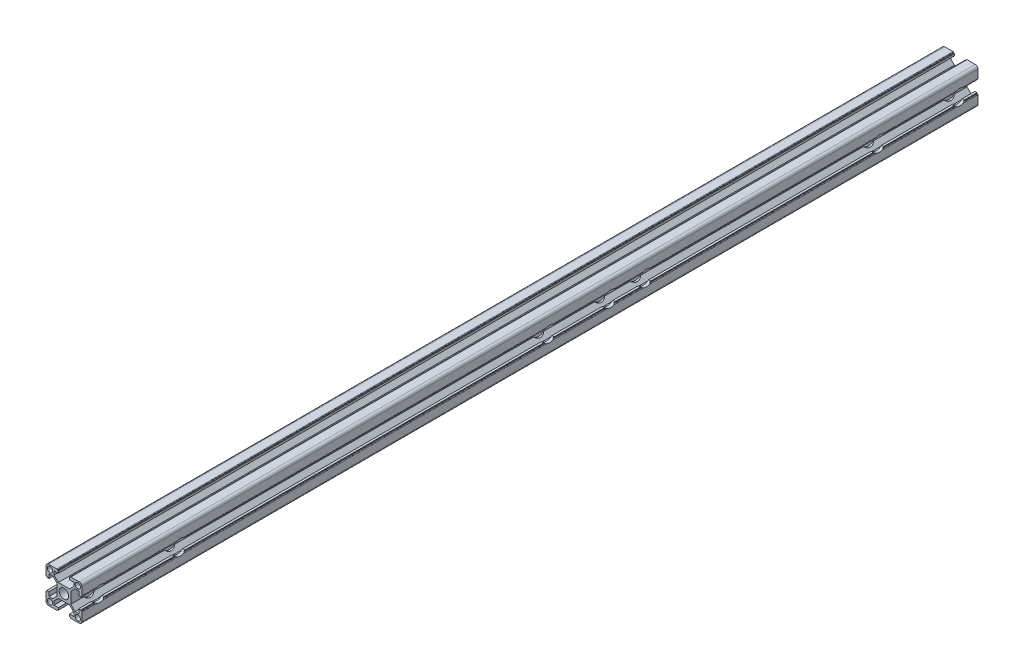
from build123d import *

# Parameters (mm, degrees)
SKETCH_1_R          = 2.65
SKETCH_1_R_2        = 1.5
EXTRUDE_1_DEPTH     = 250
SKETCH_4_R          = 2
CUT_EXTRUDE_3_DEPTH = 251.582965303
SKETCH_5_R          = 4.25
CUT_EXTRUDE_4_DEPTH = 251.582965403
SKETCH_6_R          = 2
CUT_EXTRUDE_5_DEPTH = 251.582965403
SKETCH_7_R          = 4.25
CUT_EXTRUDE_6_DEPTH = 251.582965403
SKETCH_8_R          = 2.1
CUT_EXTRUDE_7_DEPTH = 251.582965403
SKETCH_9_R          = 4.25
CUT_EXTRUDE_8_DEPTH = 251.582965408


with BuildPart() as part:
    # 草图1 → 凸台-拉伸1 (new, symmetric)
    with BuildSketch(Plane.XY):
        with BuildLine():
            Line((3.142893219, 3.85), (-3.142893219, 3.85))
            Line((-3.142893219, 3.85), (-5.5, 6.207106781))
            Line((-5.5, 6.207106781), (-5.5, 8.3))
            Line((-5.5, 8.3), (-3.1, 8.3))
            Line((-3.1, 8.3), (-3.1, 9.5))
            Line((-3.1, 9.5), (-3.6, 9.5))
            Line((-3.6, 9.5), (-3.6, 9.7))
            ThreePointArc((-3.6, 9.7), (-3.687867966, 9.912132034), (-3.9, 10))
            Line((-3.9, 10), (-8.5, 10))
            ThreePointArc((-8.5, 10), (-9.560660172, 9.560660172), (-10, 8.5))
            Line((-10, 8.5), (-10, 3.9))
            ThreePointArc((-10, 3.9), (-9.912132034, 3.687867966), (-9.7, 3.6))
            Line((-9.7, 3.6), (-9.5, 3.6))
            Line((-9.5, 3.6), (-9.5, 3.1))
            Line((-9.5, 3.1), (-8.3, 3.1))
            Line((-8.3, 3.1), (-8.3, 5.5))
            Line((-8.3, 5.5), (-6.207106781, 5.5))
            Line((-6.207106781, 5.5), (-3.85, 3.142893219))
            Line((-3.85, 3.142893219), (-3.85, -3.142893219))
            Line((-3.85, -3.142893219), (-6.207106781, -5.5))
            Line((-6.207106781, -5.5), (-8.3, -5.5))
            Line((-8.3, -5.5), (-8.3, -3.1))
            Line((-8.3, -3.1), (-9.5, -3.1))
            Line((-9.5, -3.1), (-9.5, -3.6))
            Line((-9.5, -3.6), (-9.7, -3.6))
            ThreePointArc((-9.7, -3.6), (-9.912132034, -3.687867966), (-10, -3.9))
            Line((-10, -3.9), (-10, -8.5))
            ThreePointArc((-10, -8.5), (-9.560660172, -9.560660172), (-8.5, -10))
            Line((-8.5, -10), (-3.9, -10))
            ThreePointArc((-3.9, -10), (-3.687867966, -9.912132034), (-3.6, -9.7))
            Line((-3.6, -9.7), (-3.6, -9.5))
            Line((-3.6, -9.5), (-3.1, -9.5))
            Line((-3.1, -9.5), (-3.1, -8.3))
            Line((-3.1, -8.3), (-5.5, -8.3))
            Line((-5.5, -8.3), (-5.5, -6.207106781))
            Line((-5.5, -6.207106781), (-3.142893219, -3.85))
            Line((-3.142893219, -3.85), (3.142893219, -3.85))
            Line((3.142893219, -3.85), (5.5, -6.207106781))
            Line((5.5, -6.207106781), (5.5, -8.3))
            Line((5.5, -8.3), (3.1, -8.3))
            Line((3.1, -8.3), (3.1, -9.5))
            Line((3.1, -9.5), (3.6, -9.5))
            Line((3.6, -9.5), (3.6, -9.7))
            ThreePointArc((3.6, -9.7), (3.687867966, -9.912132034), (3.9, -10))
            Line((3.9, -10), (8.5, -10))
            ThreePointArc((8.5, -10), (9.560660172, -9.560660172), (10, -8.5))
            Line((10, -8.5), (10, -3.9))
            ThreePointArc((10, -3.9), (9.912132034, -3.687867966), (9.7, -3.6))
            Line((9.7, -3.6), (9.5, -3.6))
            Line((9.5, -3.6), (9.5, -3.1))
            Line((9.5, -3.1), (8.3, -3.1))
            Line((8.3, -3.1), (8.3, -5.5))
            Line((8.3, -5.5), (6.207106781, -5.5))
            Line((6.207106781, -5.5), (3.85, -3.142893219))
            Line((3.85, -3.142893219), (3.85, 3.142893219))
            Line((3.85, 3.142893219), (6.207106781, 5.5))
            Line((6.207106781, 5.5), (8.3, 5.5))
            Line((8.3, 5.5), (8.3, 3.1))
            Line((8.3, 3.1), (9.5, 3.1))
            Line((9.5, 3.1), (9.5, 3.6))
            Line((9.5, 3.6), (9.7, 3.6))
            ThreePointArc((9.7, 3.6), (9.912132034, 3.687867966), (10, 3.9))
            Line((10, 3.9), (10, 8.5))
            ThreePointArc((10, 8.5), (9.560660172, 9.560660172), (8.5, 10))
            Line((8.5, 10), (3.9, 10))
            ThreePointArc((3.9, 10), (3.687867966, 9.912132034), (3.6, 9.7))
            Line((3.6, 9.7), (3.6, 9.5))
            Line((3.6, 9.5), (3.1, 9.5))
            Line((3.1, 9.5), (3.1, 8.3))
            Line((3.1, 8.3), (5.5, 8.3))
            Line((5.5, 8.3), (5.5, 6.207106781))
            Line((5.5, 6.207106781), (3.142893219, 3.85))
        make_face()
        Circle(SKETCH_1_R, mode=Mode.SUBTRACT)
        with Locations((-7.75, 7.75)):
            Circle(SKETCH_1_R_2, mode=Mode.SUBTRACT)
        with Locations((7.75, 7.75)):
            Circle(SKETCH_1_R_2, mode=Mode.SUBTRACT)
        with Locations((7.75, -7.75)):
            Circle(SKETCH_1_R_2, mode=Mode.SUBTRACT)
        with Locations((-7.75, -7.75)):
            Circle(SKETCH_1_R_2, mode=Mode.SUBTRACT)
    extrude(amount=EXTRUDE_1_DEPTH, both=True)

    # 草图4 → 切除-拉伸3 (cut, through all)
    with BuildSketch(Plane(origin=(3.85, 0, 0), x_dir=(0, 0, -1), z_dir=(1, 0, 0))):
        with Locations((-240, 0)):
            Circle(SKETCH_4_R)
        with Locations((240, 0)):
            Circle(SKETCH_4_R)
        with Locations((-195, 0)):
            Circle(SKETCH_4_R)
        with Locations((195, 0)):
            Circle(SKETCH_4_R)
        with Locations((65, 0)):
            Circle(SKETCH_4_R)
    extrude(amount=-CUT_EXTRUDE_3_DEPTH, mode=Mode.SUBTRACT)

    # 草图5 → 切除-拉伸4 (cut, through all)
    with BuildSketch(Plane(origin=(3.85, 0, 0), x_dir=(0, 0, -1), z_dir=(1, 0, 0))):
        with Locations((195, 0)):
            Circle(SKETCH_5_R)
        with Locations((240, 0)):
            Circle(SKETCH_5_R)
        with Locations((65, 0)):
            Circle(SKETCH_5_R)
        with Locations((-240, 0)):
            Circle(SKETCH_5_R)
        with Locations((-195, 0)):
            Circle(SKETCH_5_R)
    extrude(amount=CUT_EXTRUDE_4_DEPTH, mode=Mode.SUBTRACT)

    # 草图6 → 切除-拉伸5 (cut, through all)
    with BuildSketch(Plane(origin=(3.85, 0, 0), x_dir=(0, 0, -1), z_dir=(1, 0, 0))):
        with Locations((45, 0)):
            Circle(SKETCH_6_R)
        with Locations((11, 0)):
            Circle(SKETCH_6_R)
    extrude(amount=-CUT_EXTRUDE_5_DEPTH, mode=Mode.SUBTRACT)

    # 草图7 → 切除-拉伸6 (cut, through all)
    with BuildSketch(Plane(origin=(3.85, 0, 0), x_dir=(0, 0, -1), z_dir=(1, 0, 0))):
        with Locations((45, 0)):
            Circle(SKETCH_7_R)
        with Locations((11, 0)):
            Circle(SKETCH_7_R)
    extrude(amount=CUT_EXTRUDE_6_DEPTH, mode=Mode.SUBTRACT)

    # 草图8 → 切除-拉伸7 (cut, through all)
    with BuildSketch(Plane(origin=(3.85, 0, 0), x_dir=(0, 0, -1), z_dir=(1, 0, 0))):
        with Locations((-43, 0)):
            Circle(SKETCH_8_R)
        with Locations((-9, 0)):
            Circle(SKETCH_8_R)
    extrude(amount=-CUT_EXTRUDE_7_DEPTH, mode=Mode.SUBTRACT)

    # 草图9 → 切除-拉伸8 (cut, through all)
    with BuildSketch(Plane.ZY.offset(3.85)):
        with Locations((9, 0)):
            Circle(SKETCH_9_R)
        with Locations((43, 0)):
            Circle(SKETCH_9_R)
    extrude(amount=CUT_EXTRUDE_8_DEPTH, mode=Mode.SUBTRACT)


solid = part.part
